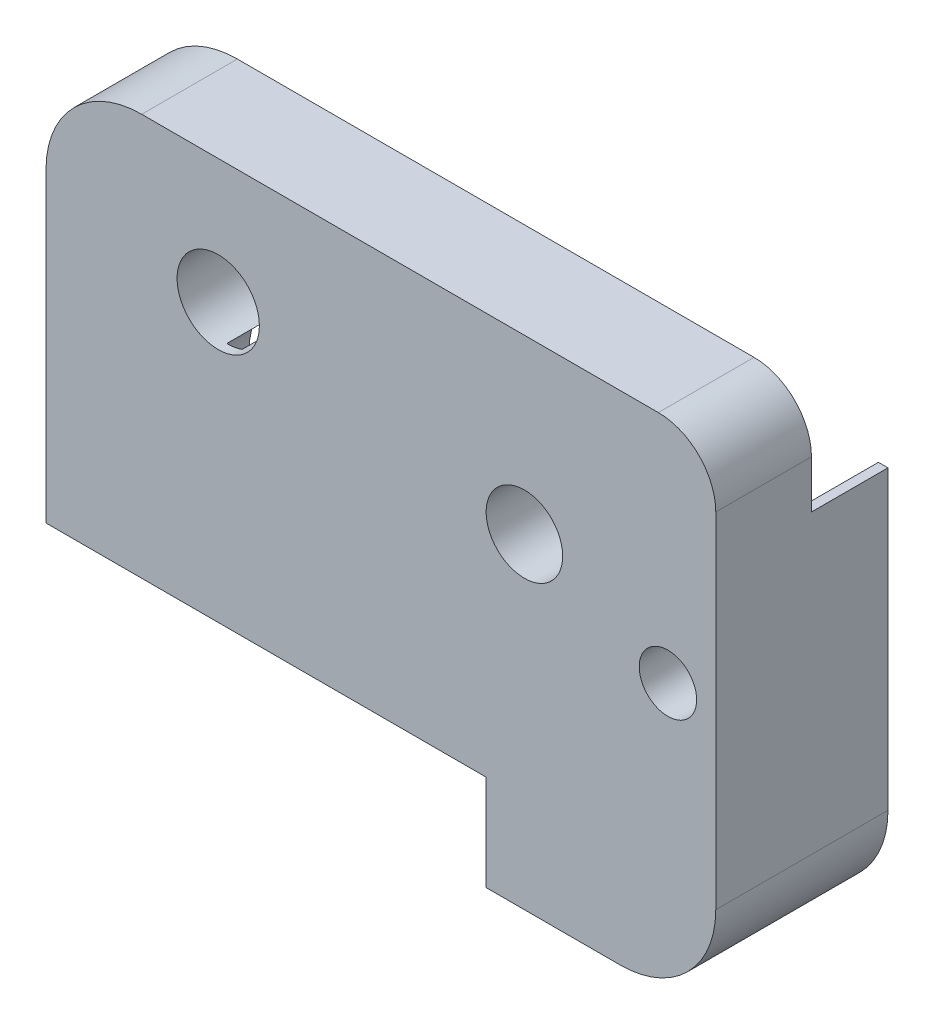
from build123d import *

# Parameters (mm, degrees)
SKETCH1_W             = 23
SKETCH1_H             = 21
EXTRUDE1_DEPTH        = 5
SKETCH2_R             = 2.15
EXTRUDE2_DEPTH        = 4.3
SKETCH3_R             = 4.5
EXTRUDE3_DEPTH        = 4.5
SKETCH4_R             = 1.25
EXTRUDE4_DEPTH        = 8
SKETCH7_W             = 12
SKETCH7_H             = 26
EXTRUDE6_DEPTH        = 5
SKETCH9_R             = 1.5
EXTRUDE8_DEPTH        = 5
SKETCH8_R             = 2
EXTRUDE7_DEPTH        = 4
FILLET2_R             = 3
M3_TAPPED_HOLE1_D     = 2.5
M3_TAPPED_HOLE1_DEPTH = 8
M3_TAPPED_HOLE1_TIP   = 0.751075774
EXTRUDE9_DEPTH        = 4
FILLET1_R             = 5
EXTRUDE10_DEPTH       = 4
FILLET3_R             = 2


with BuildPart() as part:
    # Sketch1 → Extrude1 (new body)
    with BuildSketch(Plane.XY):
        with Locations((-3.5, -4)):
            Rectangle(SKETCH1_W, SKETCH1_H)
    extrude(amount=EXTRUDE1_DEPTH)

    # Sketch2 → Extrude2 (cut)
    with BuildSketch(Plane.XY.offset(5)):
        with Locations((-6, 0)):
            Circle(SKETCH2_R)
    extrude(amount=-EXTRUDE2_DEPTH, mode=Mode.SUBTRACT)

    # Sketch3 → Extrude3 (cut)
    with BuildSketch(Plane(origin=(0, 0, 0), x_dir=(-1, 0, 0), z_dir=(0, 0, -1))):
        with Locations((4.9, -6.5)):
            Circle(SKETCH3_R)
    extrude(amount=-EXTRUDE3_DEPTH, mode=Mode.SUBTRACT)

    # Sketch4 → Extrude4 (cut)
    with BuildSketch(Plane.XZ.offset(14.5)):
        with Locations(Location((-12, 2.5, 0), (0, 0, 270))):
            Circle(SKETCH4_R)
        with Locations(Location((1.4, 2.5, 0), (0, 0, 270))):
            Circle(SKETCH4_R)
    extrude(amount=-EXTRUDE4_DEPTH, mode=Mode.SUBTRACT)

    # Sketch7 → Extrude6 (add)
    with BuildSketch(Plane.XY.offset(5)):
        with Locations((14, -6.5)):
            Rectangle(SKETCH7_W, SKETCH7_H)
    extrude(amount=-EXTRUDE6_DEPTH)

    # Sketch9 → Extrude8 (cut)
    with BuildSketch(Plane.XY.offset(5)):
        with Locations((17.5, -5.5)):
            Circle(SKETCH9_R)
    extrude(amount=-EXTRUDE8_DEPTH, mode=Mode.SUBTRACT)

    # Sketch8 → Extrude7 (cut)
    with BuildSketch(Plane.XY.offset(5)):
        with Locations((10, -2.5)):
            Circle(SKETCH8_R)
    extrude(amount=-EXTRUDE7_DEPTH, mode=Mode.SUBTRACT)

    # Fillet2
    fillet2_edges = [part.edges().sort_by_distance(p)[0] for p in [
        (20, 6.5, 2.5),
        (20, -19.5, 2.5),
    ]]
    fillet(fillet2_edges, radius=FILLET2_R)

    # M3 Tapped Hole1
    with Locations(Plane(origin=(-12, -14.5, 2.5), x_dir=(0, 0, -1), z_dir=(0, -1, 0))):
        with Locations((0, 0), (0, 13.4)):
            Hole(M3_TAPPED_HOLE1_D / 2, depth=M3_TAPPED_HOLE1_DEPTH)
            with Locations((0, 0, -(M3_TAPPED_HOLE1_DEPTH + M3_TAPPED_HOLE1_TIP / 2))):  # 118° drill point
                Cone(0, M3_TAPPED_HOLE1_D / 2, M3_TAPPED_HOLE1_TIP, mode=Mode.SUBTRACT)

    # Sketch11 → Extrude9 (add)
    with BuildSketch(Plane(origin=(0, 0, 0), x_dir=(-1, 0, 0), z_dir=(0, 0, -1))):
        Polygon((-8, -19.5), (-20, -19.5), (-20, 1), (-18.1, 1), (-2, -11.07), (-2, -14.5), (-8, -14.5), align=None)
    extrude(amount=EXTRUDE9_DEPTH)

    # Fillet1
    fillet1_edges = [part.edges().sort_by_distance(p)[0] for p in [
        (-15, 6.5, 2.5),
        (20, -19.5, -2),
    ]]
    fillet(fillet1_edges, radius=FILLET1_R)

    # Sketch12 → Extrude10 (cut)
    with BuildSketch(Plane(origin=(0, 0, -4), x_dir=(-1, 0, 0), z_dir=(0, 0, -1))):
        Polygon((-19.5, 1), (-19.5, -7.5), (-15.5, -7.5), (-15.5, -0.949192547), (-18.1, 1), align=None)
    extrude(amount=-EXTRUDE10_DEPTH, mode=Mode.SUBTRACT)

    # Fillet3
    fillet3_edges = [part.edges().sort_by_distance(p)[0] for p in [
        (15.5, -7.5, -2),
        (19.5, -7.5, -2),
    ]]
    fillet(fillet3_edges, radius=FILLET3_R - 0.0001)  # a hair under: the kernel refuses the full size


solid = part.part
